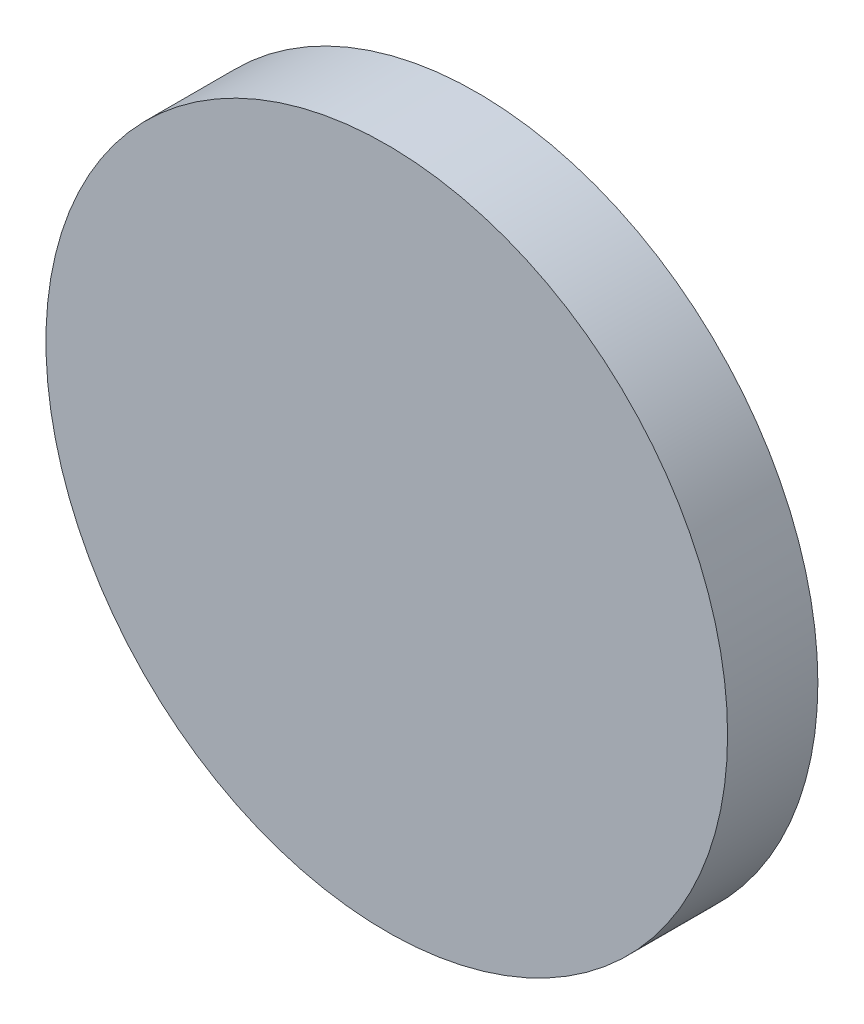
from build123d import *

# Parameters (mm, degrees)
SKETCH1_R           = 4.55
SKETCH1_R_2         = 2.55
BOSS_EXTRUDE1_DEPTH = 1.75
SKETCH2_R           = 7.55
BOSS_EXTRUDE2_DEPTH = 2


with BuildPart() as part:
    # Sketch1 → Boss-Extrude1 (new body)
    with BuildSketch(Plane.XY):
        Circle(SKETCH1_R)
        Circle(SKETCH1_R_2, mode=Mode.SUBTRACT)
    extrude(amount=-BOSS_EXTRUDE1_DEPTH)

    # Sketch2 → Boss-Extrude2 (add)
    with BuildSketch(Plane.XY):
        Circle(SKETCH2_R)
    extrude(amount=BOSS_EXTRUDE2_DEPTH)


solid = part.part
